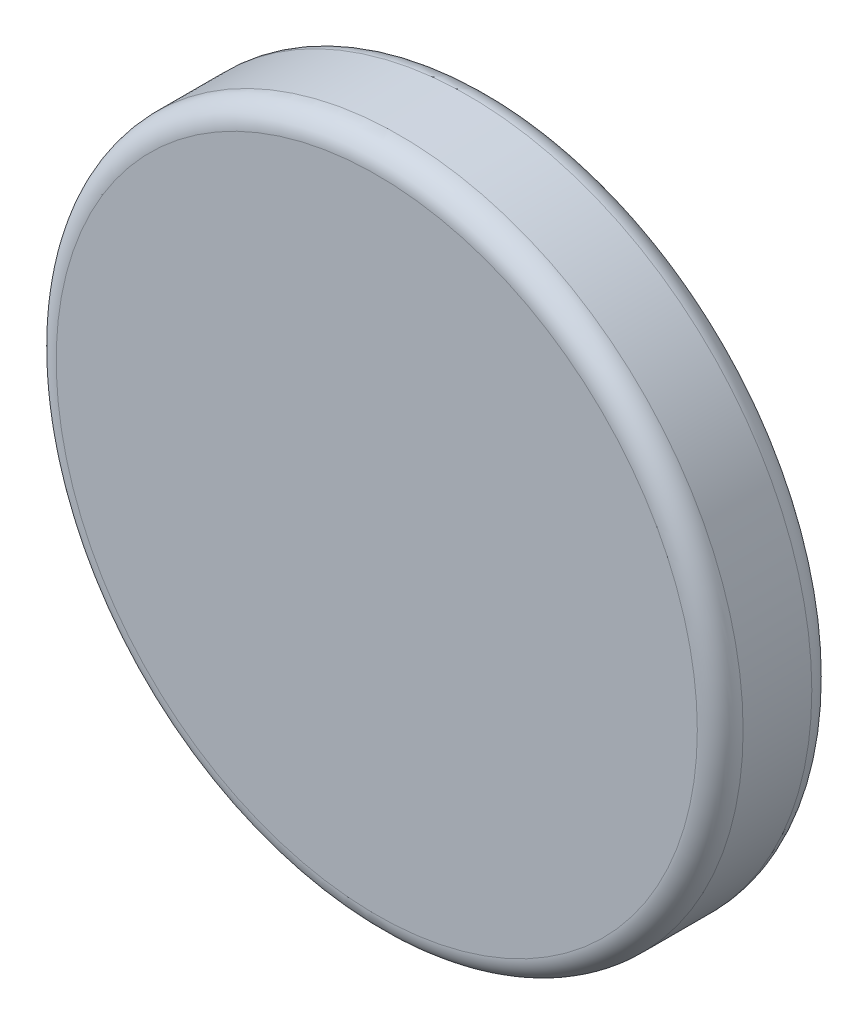
from build123d import *

# Parameters (mm, degrees)
SKETCH_1_R      = 3
EXTRUDE_1_DEPTH = 1
FILLET_1_R      = 0.2


with BuildPart() as part:
    # Эскиз1 → Бобышка-Вытянуть1 (new body)
    with BuildSketch(Plane.XY):
        Circle(SKETCH_1_R)
    extrude(amount=EXTRUDE_1_DEPTH)

    # Скругление1
    fillet_1_edges = [part.edges().sort_by_distance(p)[0] for p in [
        (-3, 0, 0),
        (-3, 0, 1),
    ]]
    fillet(fillet_1_edges, radius=FILLET_1_R)


solid = part.part
